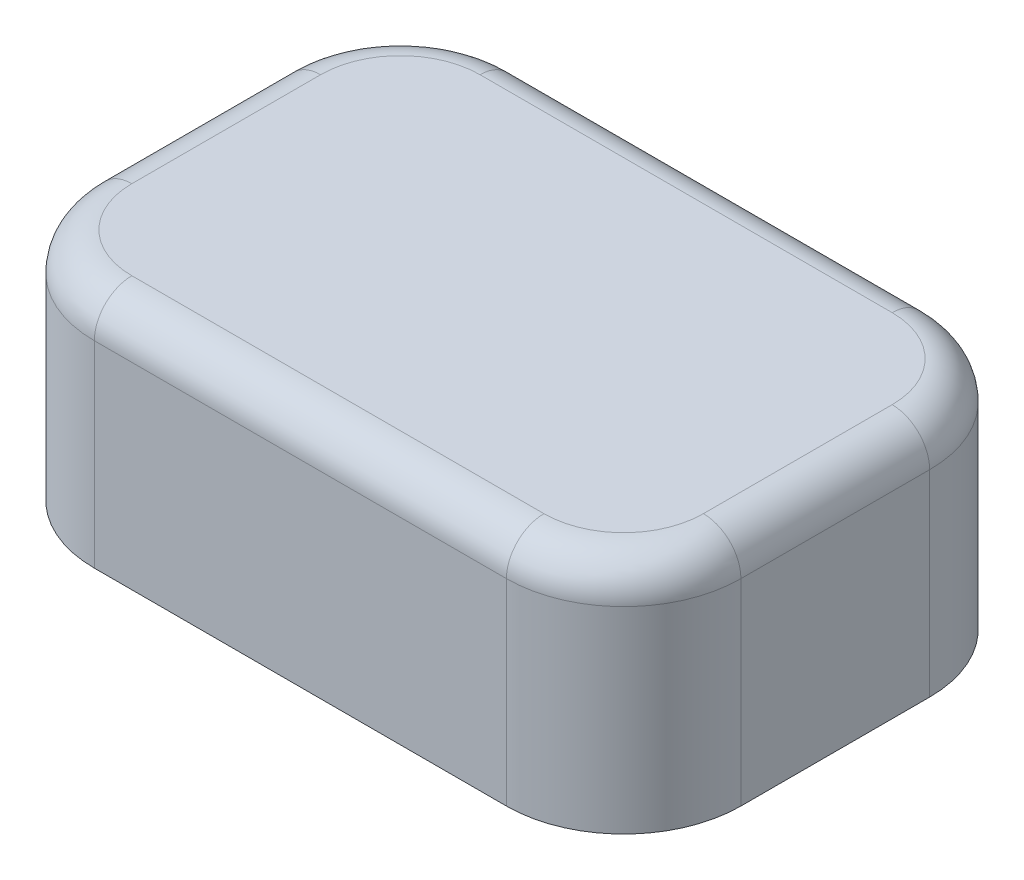
from build123d import *

# Parameters (mm, degrees)
SKETCH_1_R      = 2.8
EXTRUDE_1_DEPTH = 8
SKETCH_2_W      = 27.575
SKETCH_2_H      = 18.05
EXTRUDE_2_DEPTH = 1
SKETCH_3_W      = 27.575
SKETCH_3_H      = 18.05
SKETCH_3_W_2    = 25.575
SKETCH_3_H_2    = 16.05
EXTRUDE_3_DEPTH = 9
SKETCH_6_W      = 1.2
SKETCH_6_H      = 5.825
SKETCH_6_W_2    = 10.5875
SKETCH_6_H_2    = 1.2
EXTRUDE_4_DEPTH = 2.5
FILLET_1_R      = 5
FILLET_2_R      = 1.6


with BuildPart() as part:
    # 草图1 → 凸台-拉伸1 (new body)
    with BuildSketch(Plane(origin=(0, 0, 0), x_dir=(1, 0, 0), z_dir=(0, 1, 0))):
        Circle(SKETCH_1_R)
        Polygon((2.2, 0.6), (2.2, -0.6), (0.6, -0.6), (0.6, -2.2), (-0.6, -2.2), (-0.6, -0.6), (-2.2, -0.6), (-2.2, 0.6), (-0.6, 0.6), (-0.6, 2.2), (0.6, 2.2), (0.6, 0.6), align=None, mode=Mode.SUBTRACT)
    extrude(amount=-EXTRUDE_1_DEPTH)

    # 草图2 → 凸台-拉伸2 (add)
    with BuildSketch(Plane(origin=(0, 0, 0), x_dir=(1, 0, 0), z_dir=(0, 1, 0))):
        Rectangle(SKETCH_2_W, SKETCH_2_H)
    extrude(amount=EXTRUDE_2_DEPTH)

    # 草图3 → 凸台-拉伸3 (add)
    with BuildSketch(Plane(origin=(0, 0, 0), x_dir=(1, 0, 0), z_dir=(0, 1, 0))):
        Rectangle(SKETCH_3_W, SKETCH_3_H)
        Rectangle(SKETCH_3_W_2, SKETCH_3_H_2, mode=Mode.SUBTRACT)
    extrude(amount=-EXTRUDE_3_DEPTH)

    # 草图6 → 凸台-拉伸4 (add)
    with BuildSketch(Plane(origin=(0, 0, 0), x_dir=(1, 0, 0), z_dir=(0, 1, 0))):
        with Locations((0, 5.1125)):
            Rectangle(SKETCH_6_W, SKETCH_6_H)
        with Locations((7.49375, 0)):
            Rectangle(SKETCH_6_W_2, SKETCH_6_H_2)
        with Locations((0, -5.1125)):
            Rectangle(SKETCH_6_W, SKETCH_6_H)
        with Locations((-7.49375, 0)):
            Rectangle(SKETCH_6_W_2, SKETCH_6_H_2)
    extrude(amount=-EXTRUDE_4_DEPTH)

    # 圆角1
    fillet_1_edges = [part.edges().sort_by_distance(p)[0] for p in [
        (13.7875, -4, -9.025),
        (13.7875, -4, 9.025),
        (-13.7875, -4, 9.025),
        (-13.7875, -4, -9.025),
        (-12.7875, -4.5, -8.025),
        (12.7875, -4.5, -8.025),
        (12.7875, -4.5, 8.025),
        (-12.7875, -4.5, 8.025),
    ]]
    fillet(fillet_1_edges, radius=FILLET_1_R)

    # 圆角2
    fillet_2_edges = [part.edges().sort_by_distance(p)[0] for p in [
        (12.7875, 0, 1.8125),
        (4.19375, 0, 8.025),
        (-4.19375, 0, 8.025),
        (-12.7875, 0, 1.8125),
        (-12.7875, 0, -1.8125),
        (-4.19375, 0, -8.025),
        (4.19375, 0, -8.025),
        (12.7875, 0, -1.8125),
        (12.323033906, 1, 7.560533906),
        (0, 1, 9.025),
        (-12.323033906, 1, 7.560533906),
        (-13.7875, 1, 0),
        (-12.323033906, 1, -7.560533906),
        (0, 1, -9.025),
        (12.323033906, 1, -7.560533906),
        (13.7875, 1, 0),
        (11.323033906, 0, 6.560533906),
        (-11.323033906, 0, 6.560533906),
        (-11.323033906, 0, -6.560533906),
        (11.323033906, 0, -6.560533906),
    ]]
    fillet(fillet_2_edges, radius=FILLET_2_R)


solid = part.part
